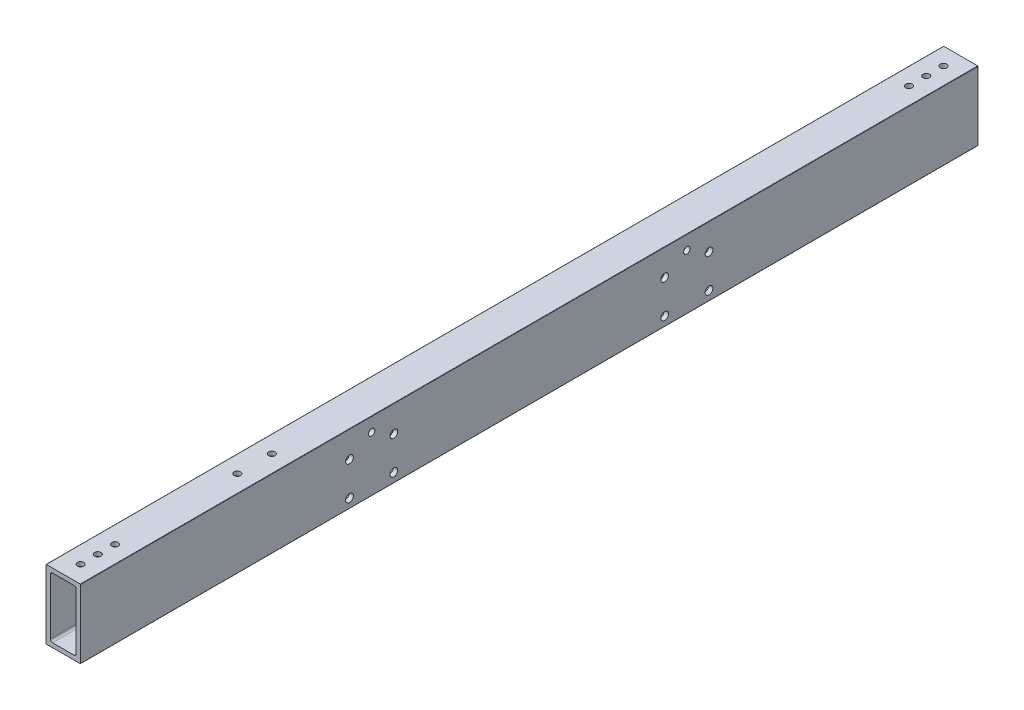
from build123d import *

# Parameters (mm, degrees)
CUT_EXTRUDE1_START = -1828.8
CUT_EXTRUDE1_DEPTH = 660.4
SKETCH3_R          = 2.38125
CUT_EXTRUDE3_DEPTH = 50.8
CUT_EXTRUDE4_REACH = 664.838
SKETCH4_R          = 2.413
CUT_EXTRUDE5_REACH = 664.838
SKETCH5_R          = 2.85115
SKETCH6_R          = 2.38125
CUT_EXTRUDE6_DEPTH = 663.837808315


with BuildPart() as part:
    # Cut-Extrude1: read off the stored shape, not the designer's step
    # Cut-Extrude1 outline → Cut-Extrude1 (new body)
    with BuildSketch(Plane.XY.offset(1828.8).offset(CUT_EXTRUDE1_START)):
        with BuildLine():
            Line((0, 50.546), (0, 0.254))
            ThreePointArc((0, 0.254), (0.074394878, 0.074394878), (0.254, 0))
            Line((0.254, 0), (25.146, 0))
            ThreePointArc((25.146, 0), (25.325605122, 0.074394878), (25.4, 0.254))
            Line((25.4, 0.254), (25.4, 50.546))
            ThreePointArc((25.4, 50.546), (25.325605122, 50.725605122), (25.146, 50.8))
            Line((25.146, 50.8), (0.254, 50.8))
            ThreePointArc((0.254, 50.8), (0.074394878, 50.725605122), (0, 50.546))
        make_face()
        with BuildLine():
            ThreePointArc((4.7625, 3.175), (3.639967985, 3.639967985), (3.175, 4.7625))
            Line((3.175, 4.7625), (3.175, 46.0375))
            ThreePointArc((3.175, 46.0375), (3.639967985, 47.160032015), (4.7625, 47.625))
            Line((4.7625, 47.625), (20.6375, 47.625))
            ThreePointArc((20.6375, 47.625), (21.760032015, 47.160032015), (22.225, 46.0375))
            Line((22.225, 46.0375), (22.225, 4.7625))
            ThreePointArc((22.225, 4.7625), (21.760032015, 3.639967985), (20.6375, 3.175))
            Line((20.6375, 3.175), (4.7625, 3.175))
        make_face(mode=Mode.SUBTRACT)
    extrude(amount=CUT_EXTRUDE1_DEPTH)

    # Sketch3 → Cut-Extrude3 (cut)
    with BuildSketch(Plane(origin=(0, 50.8, 0), x_dir=(1, 0, 0), z_dir=(0, 1, 0))):
        with Locations(Location((12.7, -25.4, 0), (0, 0, 270))):
            Circle(SKETCH3_R)
        with Locations(Location((12.7, -12.7, 0), (0, 0, 270))):
            Circle(SKETCH3_R)
        with Locations(Location((12.7, -38.1, 0), (0, 0, 270))):
            Circle(SKETCH3_R)
        with Locations(Location((12.7, -622.3, 0), (0, 0, 270))):
            Circle(SKETCH3_R)
        with Locations(Location((12.7, -635, 0), (0, 0, 270))):
            Circle(SKETCH3_R)
        with Locations(Location((12.7, -647.7, 0), (0, 0, 270))):
            Circle(SKETCH3_R)
    extrude(amount=-CUT_EXTRUDE3_DEPTH, mode=Mode.SUBTRACT)

    # Sketch4 → Cut-Extrude4 (cut, up to next)
    with BuildSketch(Plane(origin=(0, 50.8, 0), x_dir=(1, 0, 0), z_dir=(0, 1, 0)), mode=Mode.PRIVATE) as cut_extrude4_sk1:
        with Locations(Location((12.7, -532.289940881, 0), (0, 0, 270))):
            Circle(SKETCH4_R)
    cut_extrude4_tool1 = extrude(cut_extrude4_sk1.sketch, amount=-CUT_EXTRUDE4_REACH, mode=Mode.PRIVATE) & part.part
    # Sketch4 → Cut-Extrude4 (cut, up to next)
    with BuildSketch(Plane(origin=(0, 50.8, 0), x_dir=(1, 0, 0), z_dir=(0, 1, 0)), mode=Mode.PRIVATE) as cut_extrude4_sk2:
        with Locations(Location((12.7, -506.889940881, 0), (0, 0, 270))):
            Circle(SKETCH4_R)
    cut_extrude4_tool2 = extrude(cut_extrude4_sk2.sketch, amount=-CUT_EXTRUDE4_REACH, mode=Mode.PRIVATE) & part.part
    add(cut_extrude4_tool1.solids().sort_by_distance((12.7, 50.8, 532.289941))[0], mode=Mode.SUBTRACT)
    add(cut_extrude4_tool2.solids().sort_by_distance((12.7, 50.8, 506.889941))[0], mode=Mode.SUBTRACT)

    # Sketch5 → Cut-Extrude5 (cut, up to next)
    with BuildSketch(Plane(origin=(25.4, 0, 0), x_dir=(0, 0, -1), z_dir=(1, 0, 0)), mode=Mode.PRIVATE) as cut_extrude5_sk1:
        with Locations((-462.47685, 31.33725)):
            Circle(SKETCH5_R)
    cut_extrude5_tool1 = extrude(cut_extrude5_sk1.sketch, amount=-CUT_EXTRUDE5_REACH, mode=Mode.PRIVATE) & part.part
    # Sketch5 → Cut-Extrude5 (cut, up to next)
    with BuildSketch(Plane(origin=(25.4, 0, 0), x_dir=(0, 0, -1), z_dir=(1, 0, 0)), mode=Mode.PRIVATE) as cut_extrude5_sk2:
        with Locations((-429.82515, 31.33725)):
            Circle(SKETCH5_R)
    cut_extrude5_tool2 = extrude(cut_extrude5_sk2.sketch, amount=-CUT_EXTRUDE5_REACH, mode=Mode.PRIVATE) & part.part
    # Sketch5 → Cut-Extrude5 (cut, up to next)
    with BuildSketch(Plane(origin=(25.4, 0, 0), x_dir=(0, 0, -1), z_dir=(1, 0, 0)), mode=Mode.PRIVATE) as cut_extrude5_sk3:
        with Locations((-429.82515, 6.76275)):
            Circle(SKETCH5_R)
    cut_extrude5_tool3 = extrude(cut_extrude5_sk3.sketch, amount=-CUT_EXTRUDE5_REACH, mode=Mode.PRIVATE) & part.part
    # Sketch5 → Cut-Extrude5 (cut, up to next)
    with BuildSketch(Plane(origin=(25.4, 0, 0), x_dir=(0, 0, -1), z_dir=(1, 0, 0)), mode=Mode.PRIVATE) as cut_extrude5_sk4:
        with Locations((-462.47685, 6.76275)):
            Circle(SKETCH5_R)
    cut_extrude5_tool4 = extrude(cut_extrude5_sk4.sketch, amount=-CUT_EXTRUDE5_REACH, mode=Mode.PRIVATE) & part.part
    # Sketch5 → Cut-Extrude5 (cut, up to next)
    with BuildSketch(Plane(origin=(25.4, 0, 0), x_dir=(0, 0, -1), z_dir=(1, 0, 0)), mode=Mode.PRIVATE) as cut_extrude5_sk5:
        with Locations((-197.92315, 6.76275)):
            Circle(SKETCH5_R)
    cut_extrude5_tool5 = extrude(cut_extrude5_sk5.sketch, amount=-CUT_EXTRUDE5_REACH, mode=Mode.PRIVATE) & part.part
    # Sketch5 → Cut-Extrude5 (cut, up to next)
    with BuildSketch(Plane(origin=(25.4, 0, 0), x_dir=(0, 0, -1), z_dir=(1, 0, 0)), mode=Mode.PRIVATE) as cut_extrude5_sk6:
        with Locations((-230.57485, 31.33725)):
            Circle(SKETCH5_R)
    cut_extrude5_tool6 = extrude(cut_extrude5_sk6.sketch, amount=-CUT_EXTRUDE5_REACH, mode=Mode.PRIVATE) & part.part
    # Sketch5 → Cut-Extrude5 (cut, up to next)
    with BuildSketch(Plane(origin=(25.4, 0, 0), x_dir=(0, 0, -1), z_dir=(1, 0, 0)), mode=Mode.PRIVATE) as cut_extrude5_sk7:
        with Locations((-197.92315, 31.33725)):
            Circle(SKETCH5_R)
    cut_extrude5_tool7 = extrude(cut_extrude5_sk7.sketch, amount=-CUT_EXTRUDE5_REACH, mode=Mode.PRIVATE) & part.part
    # Sketch5 → Cut-Extrude5 (cut, up to next)
    with BuildSketch(Plane(origin=(25.4, 0, 0), x_dir=(0, 0, -1), z_dir=(1, 0, 0)), mode=Mode.PRIVATE) as cut_extrude5_sk8:
        with Locations((-230.57485, 6.76275)):
            Circle(SKETCH5_R)
    cut_extrude5_tool8 = extrude(cut_extrude5_sk8.sketch, amount=-CUT_EXTRUDE5_REACH, mode=Mode.PRIVATE) & part.part
    add(cut_extrude5_tool1.solids().sort_by_distance((25.4, 31.33725, 462.47685))[0], mode=Mode.SUBTRACT)
    add(cut_extrude5_tool2.solids().sort_by_distance((25.4, 31.33725, 429.82515))[0], mode=Mode.SUBTRACT)
    add(cut_extrude5_tool3.solids().sort_by_distance((25.4, 6.76275, 429.82515))[0], mode=Mode.SUBTRACT)
    add(cut_extrude5_tool4.solids().sort_by_distance((25.4, 6.76275, 462.47685))[0], mode=Mode.SUBTRACT)
    add(cut_extrude5_tool5.solids().sort_by_distance((25.4, 6.76275, 197.92315))[0], mode=Mode.SUBTRACT)
    add(cut_extrude5_tool6.solids().sort_by_distance((25.4, 31.33725, 230.57485))[0], mode=Mode.SUBTRACT)
    add(cut_extrude5_tool7.solids().sort_by_distance((25.4, 31.33725, 197.92315))[0], mode=Mode.SUBTRACT)
    add(cut_extrude5_tool8.solids().sort_by_distance((25.4, 6.76275, 230.57485))[0], mode=Mode.SUBTRACT)

    # Sketch6 → Cut-Extrude6 (cut, through all)
    with BuildSketch(Plane(origin=(25.4, 0, 0), x_dir=(0, 0, -1), z_dir=(1, 0, 0))):
        with Locations((-214.249, 40.48125)):
            Circle(SKETCH6_R)
        with Locations((-446.151, 40.48125)):
            Circle(SKETCH6_R)
    extrude(amount=-CUT_EXTRUDE6_DEPTH, mode=Mode.SUBTRACT)


solid = part.part
